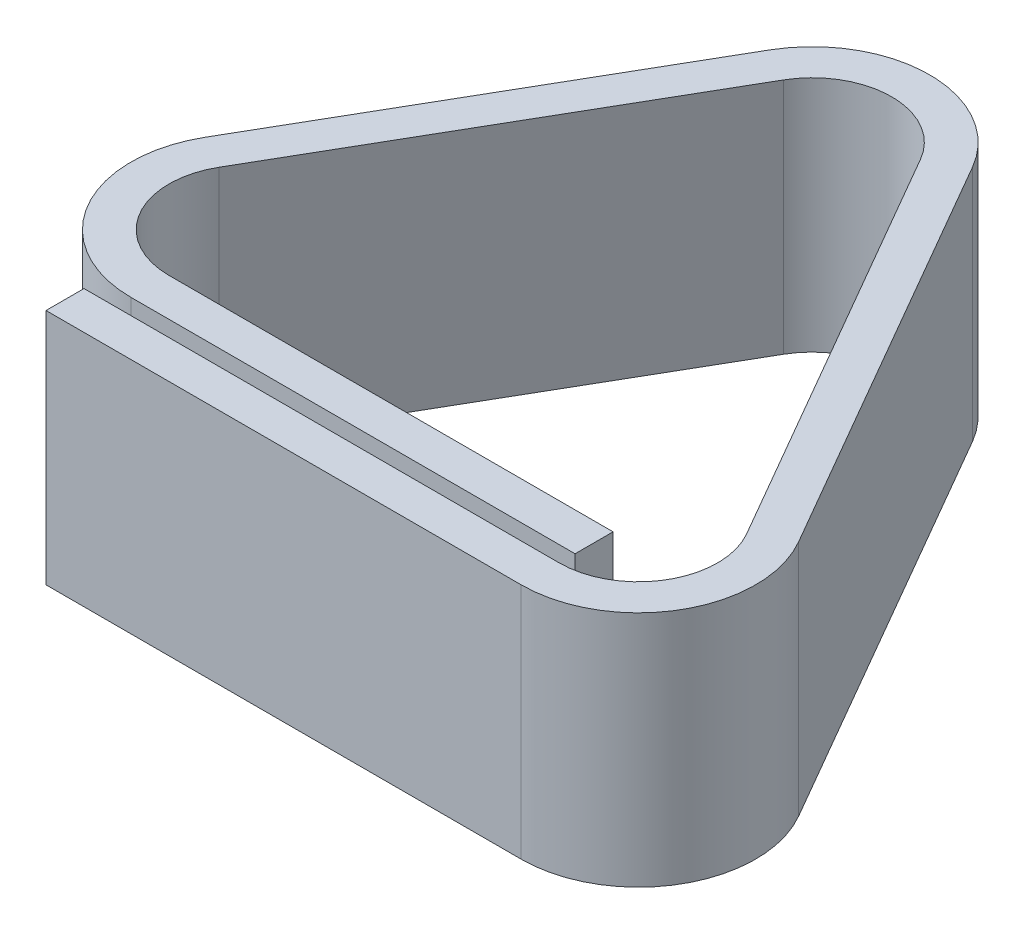
from build123d import *

# Parameters (mm, degrees)
BOSS_EXTRU_1_DEPTH = 15


with BuildPart() as part:
    # Esquisse1 → Boss.-Extru.1 (new body)
    with BuildSketch(Plane(origin=(0, 0, 0), x_dir=(1, 0, 0), z_dir=(0, 1, 0))):
        with BuildLine():
            Line((0, 0), (30, 0))
            ThreePointArc((30, 0), (34.330127019, 2.5), (34.330127019, 7.5))
            Line((34.330127019, 7.5), (19.330127019, 33.480762114))
            ThreePointArc((19.330127019, 33.480762114), (15, 35.980762114), (10.669872981, 33.480762114))
            Line((10.669872981, 33.480762114), (-2.367136104, 10.9))
            ThreePointArc((-2.367136104, 10.9), (-2.367136104, 5.9), (1.962990915, 3.4))
            Line((1.962990915, 3.4), (30, 3.4))
            Line((30, 3.4), (30, 1))
            Line((30, 1), (1.962990915, 1))
            ThreePointArc((1.962990915, 1), (-4.445597073, 4.7), (-4.445597073, 12.1))
            Line((-4.445597073, 12.1), (8.591412012, 34.680762114))
            ThreePointArc((8.591412012, 34.680762114), (15, 38.380762114), (21.408587988, 34.680762114))
            Line((21.408587988, 34.680762114), (36.408587988, 8.7))
            ThreePointArc((36.408587988, 8.7), (36.408587988, 1.3), (30, -2.4))
            Line((30, -2.4), (0, -2.4))
            Line((0, -2.4), (0, 0))
        make_face()
    extrude(amount=BOSS_EXTRU_1_DEPTH)


solid = part.part
